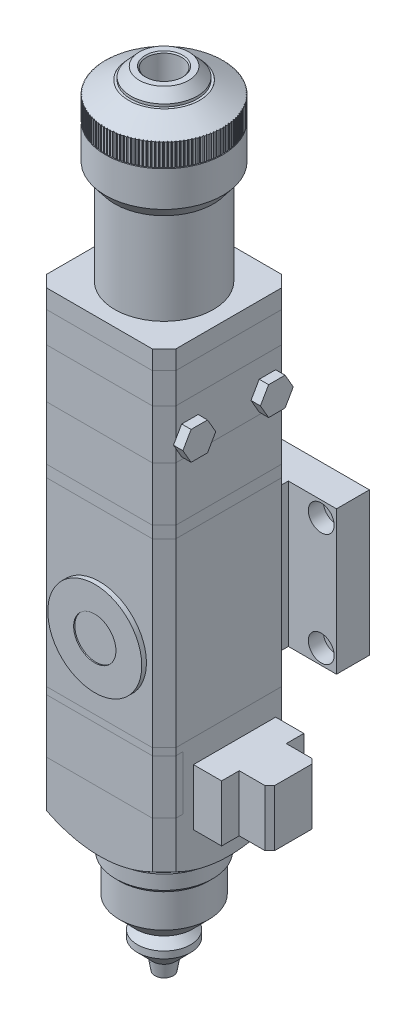
from build123d import *

# Parameters (mm, degrees)
SKETCH2_W                                    = 55
SKETCH2_H                                    = 55
BOSS_EXTRUDE1_DEPTH                          = 8
CHAMFER1_SIZE                                = 5
BOSS_EXTRUDE2_DEPTH                          = 13
BOSS_EXTRUDE3_DEPTH                          = 21
BOSS_EXTRUDE4_DEPTH                          = 23
BOSS_EXTRUDE5_DEPTH                          = 5
BOSS_EXTRUDE6_DEPTH                          = 77
BOSS_EXTRUDE7_DEPTH                          = 10
BOSS_EXTRUDE8_DEPTH                          = 25
BOSS_EXTRUDE9_DEPTH                          = 20
SKETCH15_W                                   = 81
SKETCH15_H                                   = 61
BOSS_EXTRUDE10_DEPTH                         = 14
SKETCH16_W                                   = 40
SKETCH16_H                                   = 5.4
BOSS_EXTRUDE11_DEPTH                         = 61
CBORE_FOR_M6_HEX_SOCKET_HEAD_CAP_SCR_2_COUNT = 2
CBORE_FOR_M6_HEX_SOCKET_HEAD_CAP_SCR_2_PITCH = 48
CBORE_FOR_M6_HEX_SOCKET_HEAD_CAP_SCR_3_COUNT = 2
CBORE_FOR_M6_HEX_SOCKET_HEAD_CAP_SCR_3_PITCH = 68
CBORE_FOR_M6_HEX_SOCKET_HEAD_CAP_SCR_4_COUNT = 2
CBORE_FOR_M6_HEX_SOCKET_HEAD_CAP_SCR_4_PITCH = 83.234608187
SKETCH21_R                                   = 7.5
CUT_EXTRUDE1_DEPTH                           = 64
CHAMFER2_SIZE                                = 0.5
SKETCH22_R                                   = 15.150623884
SKETCH22_R_2                                 = 14.150623884
CUT_EXTRUDE2_DEPTH                           = 5.04
CUT_EXTRUDE3_DEPTH                           = 20
CIRPATTERN1_COUNT                            = 125
SKETCH24_R                                   = 20
BOSS_EXTRUDE12_DEPTH                         = 2
SKETCH25_R                                   = 9
CUT_EXTRUDE4_DEPTH                           = 0.5
SKETCH26_W                                   = 5
SKETCH26_H                                   = 15.371413862
CUT_EXTRUDE5_DEPTH                           = 268.892703143
BOSS_EXTRUDE13_DEPTH                         = 15.371413862
BOSS_EXTRUDE14_DEPTH                         = 16
FILLET1_R                                    = 3
SKETCH29_W                                   = 55
SKETCH29_H                                   = 23
CUT_EXTRUDE6_DEPTH                           = 8
BOSS_EXTRUDE15_DEPTH                         = 23
BOSS_EXTRUDE16_DEPTH                         = 24
CHAMFER3_SIZE                                = 2
BOSS_EXTRUDE17_DEPTH                         = 4


with BuildPart() as part:
    # Sketch2 → Boss-Extrude1 (new body)
    with BuildSketch(Plane(origin=(0, 0, 0), x_dir=(1, 0, 0), z_dir=(0, 1, 0))):
        Rectangle(SKETCH2_W, SKETCH2_H)
    extrude(amount=-BOSS_EXTRUDE1_DEPTH)

    # Chamfer1
    chamfer1_edges = [part.edges().sort_by_distance(p)[0] for p in [
        (27.5, -4, 27.5),
        (-27.5, -4, 27.5),
        (-27.5, -4, -27.5),
        (27.5, -4, -27.5),
    ]]
    chamfer(chamfer1_edges, length=CHAMFER1_SIZE)

    # Sketch14 → Revolve2 (revolve)
    with BuildSketch(Plane.XY, mode=Mode.PRIVATE) as revolve2_sk:
        Polygon((0, 0), (-20.994021558, 0), (-20.994021558, 38.933369942), (-24.971974097, 44.062119831), (-24.971974097, 68.899002332), (-15.150623884, 74.207048802), (-10.497010779, 79.242887761), (0, 79.242887761), align=None)
    revolve(revolve2_sk.sketch.rotate(Axis((0, 79.242887761, 0), (0, -1, 0)), 270), axis=Axis((0, 79.242887761, 0), (0, -1, 0)))

    # Sketch21 → Cut-Extrude1 (cut)
    with BuildSketch(Plane(origin=(0, 79.242887761, 0), x_dir=(1, 0, 0), z_dir=(0, 1, 0))):
        with Locations(Location((0, 0, 0), (0, 0, 270))):
            Circle(SKETCH21_R)
    extrude(amount=-CUT_EXTRUDE1_DEPTH, mode=Mode.SUBTRACT)

    # Chamfer2
    chamfer2_edges = [part.edges().sort_by_distance(p)[0] for p in [
        (0, 79.242887761, -7.5),
    ]]
    chamfer(chamfer2_edges, length=CHAMFER2_SIZE)

    # Sketch22 → Cut-Extrude2 (cut)
    with BuildSketch(Plane(origin=(0, 79.242887761, 0), x_dir=(1, 0, 0), z_dir=(0, 1, 0))):
        with Locations(Location((0, 0, 0), (0, 0, 270))):
            Circle(SKETCH22_R)
        with Locations(Location((0, 0, 0), (0, 0, 270))):
            Circle(SKETCH22_R_2, mode=Mode.SUBTRACT)
    extrude(amount=-CUT_EXTRUDE2_DEPTH, mode=Mode.SUBTRACT)

    # Sketch23 → Cut-Extrude3 (cut)
    with BuildSketch(Plane(origin=(0, 79.242887761, 0), x_dir=(1, 0, 0), z_dir=(0, 1, 0))):
        with BuildLine():
            Line((-0.25, 24.970722663), (0, 24.671974097))
            Line((0, 24.671974097), (0.25, 24.970722663))
            ThreePointArc((0.25, 24.970722663), (0, 24.971974097), (-0.25, 24.970722663))
        make_face()
    cut_extrude3 = extrude(amount=-CUT_EXTRUDE3_DEPTH, mode=Mode.SUBTRACT)

    # CirPattern1: Cut-Extrude3 ×125 about axis
    cirpattern1_axis = Axis((0, 0, 0), (0, 1, 0))
    for i in range(1, CIRPATTERN1_COUNT):
        add(cut_extrude3.rotate(cirpattern1_axis, i * 360 / CIRPATTERN1_COUNT), mode=Mode.SUBTRACT)

    # Sketch36 → Cut-Revolve3 (revolve, cut)
    with BuildSketch(Plane.XY, mode=Mode.PRIVATE) as cut_revolve3_sk:
        Polygon((24.971974097, 59.042887761), (24.671974097, 59.242887761), (24.971974097, 59.442887761), align=None)
    revolve(cut_revolve3_sk.sketch.rotate(Axis((0, 15.242887761, 0), (0, 1, 0)), 90), axis=Axis((0, 15.242887761, 0), (0, 1, 0)), mode=Mode.SUBTRACT)


with BuildPart() as body_2:
    # Sketch4 → Boss-Extrude2 (new body)
    with BuildSketch(Plane.XZ.offset(8)):
        Polygon((27.5, -22.5), (27.5, 22.5), (22.5, 27.5), (-22.5, 27.5), (-27.5, 22.5), (-27.5, -22.5), (-22.5, -27.5), (22.5, -27.5), align=None)
    extrude(amount=BOSS_EXTRUDE2_DEPTH)


with BuildPart() as body_3:
    # Sketch5 → Boss-Extrude3 (new body)
    with BuildSketch(Plane.XZ.offset(21)):
        Polygon((-22.5, -27.5), (22.5, -27.5), (27.5, -22.5), (27.5, 22.5), (22.5, 27.5), (-22.5, 27.5), (-27.5, 22.5), (-27.5, -22.5), align=None)
    extrude(amount=BOSS_EXTRUDE3_DEPTH)


with BuildPart() as body_4:
    # Sketch6 → Boss-Extrude4 (new body)
    with BuildSketch(Plane.XZ.offset(42)):
        Polygon((-27.5, 22.5), (-27.5, -22.5), (-22.5, -27.5), (22.5, -27.5), (27.5, -22.5), (27.5, 22.5), (22.5, 27.5), (-22.5, 27.5), align=None)
    extrude(amount=BOSS_EXTRUDE4_DEPTH)


with BuildPart() as body_5:
    # Sketch7 → Boss-Extrude5 (new body)
    with BuildSketch(Plane.XZ.offset(65)):
        Polygon((22.5, 27.5), (-22.5, 27.5), (-27.5, 22.5), (-27.5, -22.5), (-22.5, -27.5), (22.5, -27.5), (27.5, -22.5), (27.5, 22.5), align=None)
    extrude(amount=BOSS_EXTRUDE5_DEPTH)


with BuildPart() as body_6:
    # Sketch8 → Boss-Extrude6 (new body)
    with BuildSketch(Plane.XZ.offset(70)):
        Polygon((27.5, -22.5), (27.5, 22.5), (22.5, 27.5), (-22.5, 27.5), (-27.5, 22.5), (-27.5, -22.5), (-22.5, -27.5), (22.5, -27.5), align=None)
    extrude(amount=BOSS_EXTRUDE6_DEPTH)



with BuildPart() as body_7:
    # Sketch9 → Boss-Extrude7 (new body)
    with BuildSketch(Plane.XZ.offset(147)):
        Polygon((-22.5, -27.5), (22.5, -27.5), (27.5, -22.5), (27.5, 22.5), (22.5, 27.5), (-22.5, 27.5), (-27.5, 22.5), (-27.5, -22.5), align=None)
    extrude(amount=BOSS_EXTRUDE7_DEPTH)


with BuildPart() as body_8:
    # Sketch10 → Boss-Extrude8 (new body)
    with BuildSketch(Plane.XZ.offset(157)):
        Polygon((-27.5, 22.5), (-27.5, -22.5), (-22.5, -27.5), (22.5, -27.5), (27.5, -22.5), (27.5, 22.5), (22.5, 27.5), (-22.5, 27.5), align=None)
    extrude(amount=BOSS_EXTRUDE8_DEPTH)

    # Sketch11 → Boss-Extrude9 (add)
    with BuildSketch(Plane.XZ.offset(182)):
        Polygon((22.5, 27.5), (-22.5, 27.5), (-27.5, 22.5), (-27.5, -22.5), (-22.5, -27.5), (22.5, -27.5), (27.5, -22.5), (27.5, 22.5), align=None)
    extrude(amount=BOSS_EXTRUDE9_DEPTH)

    # Sketch12 → Cut-Revolve1 (revolve, cut)
    with BuildSketch(Plane.XY, mode=Mode.PRIVATE) as cut_revolve1_sk:
        with BuildLine():
            Line((0, -254), (0, -202))
            Line((0, -202), (-20, -202))
            ThreePointArc((-20, -202), (-32.308689997, -195.162491871), (-43, -186))
            Line((-43, -186), (-43, -254))
            Line((-43, -254), (0, -254))
        make_face()
    revolve(cut_revolve1_sk.sketch.rotate(Axis((0, -254, 0), (0, 1, 0)), 320.710593135), axis=Axis((0, -254, 0), (0, 1, 0)), mode=Mode.SUBTRACT)

    # Sketch13 → Revolve1 (revolve)
    with BuildSketch(Plane.XY):
        Polygon((0, -202), (0, -254.147379285), (-3.915080853, -254.147379285), (-4.86862575, -248.438472983), (-11.342693732, -241.864031854), (-11.342693732, -238.953210591), (-7.578700719, -235.992202754), (-7.578700719, -232.880635197), (-12.095492334, -232.880635197), (-19.048958316, -225.819363541), (-19.048958316, -211.664827775), (-20.655662747, -210.033213199), (-20.655662747, -204.023846761), (-20, -202), align=None)
    revolve(axis=Axis((0, -202, 0), (0, -1, 0)))


with BuildPart() as body_9:
    # Sketch15 → Boss-Extrude10 (new body)
    with BuildSketch(Plane.XY.offset(-46.9)):
        with Locations((0, -110.647379285)):
            Rectangle(SKETCH15_W, SKETCH15_H)
    extrude(amount=BOSS_EXTRUDE10_DEPTH)


with BuildPart() as body_6_1:
    add(body_6.part)

    add(body_9.part)  # Boss-Extrude11 merges body 9
    # Sketch16 → Boss-Extrude11 (add)
    with BuildSketch(Plane(origin=(0, -80.147379285, 0), x_dir=(1, 0, 0), z_dir=(0, 1, 0))):
        with Locations((0, 30.2)):
            Rectangle(SKETCH16_W, SKETCH16_H)
    extrude(amount=-BOSS_EXTRUDE11_DEPTH)

    # Sketch20 → CBORE for M6 Hex Socket Head Cap Screw1 (revolve, cut)
    with BuildSketch(Plane(origin=(-34, -86.727198442, -32.9), x_dir=(0, -1, 0), z_dir=(1, 0, 0))):
        Polygon((0, 0), (0, 14), (3.2, 14), (3.2, 6.4), (5.5, 6.4), (5.5, 0), align=None)
    cbore_for_m6_hex_socket_head_cap_screw1 = revolve(axis=Axis((-34, -86.727198442, -26.55), (0, 0, -1)), mode=Mode.SUBTRACT)

    # CBORE for M6 Hex Socket Head Cap Scr 2: CBORE for M6 Hex Socket Head Cap Screw1 ×2
    with Locations(*[(0, -i * CBORE_FOR_M6_HEX_SOCKET_HEAD_CAP_SCR_2_PITCH, 0) for i in range(1, CBORE_FOR_M6_HEX_SOCKET_HEAD_CAP_SCR_2_COUNT)]):
        add(cbore_for_m6_hex_socket_head_cap_screw1, mode=Mode.SUBTRACT)

    # CBORE for M6 Hex Socket Head Cap Scr 3: CBORE for M6 Hex Socket Head Cap Screw1 ×2
    with Locations(*[(i * CBORE_FOR_M6_HEX_SOCKET_HEAD_CAP_SCR_3_PITCH, 0, 0) for i in range(1, CBORE_FOR_M6_HEX_SOCKET_HEAD_CAP_SCR_3_COUNT)]):
        add(cbore_for_m6_hex_socket_head_cap_screw1, mode=Mode.SUBTRACT)

    # CBORE for M6 Hex Socket Head Cap Scr 4: CBORE for M6 Hex Socket Head Cap Screw1 ×2
    with Locations(*[Vector(0.8169678632647617, -0.5766831975986554, 0) * (i * CBORE_FOR_M6_HEX_SOCKET_HEAD_CAP_SCR_4_PITCH) for i in range(1, CBORE_FOR_M6_HEX_SOCKET_HEAD_CAP_SCR_4_COUNT)]):
        add(cbore_for_m6_hex_socket_head_cap_screw1, mode=Mode.SUBTRACT)

    # Sketch24 → Boss-Extrude12 (add)
    with BuildSketch(Plane.XY.offset(27.5)):
        with Locations((0, -117)):
            Circle(SKETCH24_R)
    extrude(amount=BOSS_EXTRUDE12_DEPTH)

    # Sketch25 → Cut-Extrude4 (cut)
    with BuildSketch(Plane.XY.offset(29.5)):
        with Locations((0, -117)):
            Circle(SKETCH25_R)
    extrude(amount=-CUT_EXTRUDE4_DEPTH, mode=Mode.SUBTRACT)


with BuildPart() as cut_extrude5_tool:
    # Sketch26 → Cut-Extrude5 (new, through all)
    with BuildSketch(Plane.XY.offset(27.5)):
        with Locations((-25, -24.70349511)):
            Rectangle(SKETCH26_W, SKETCH26_H)
    extrude(amount=-CUT_EXTRUDE5_DEPTH)


with BuildPart() as body_2_1:
    add(body_2.part)

    # Cut-Extrude5: cut by cut_extrude5_tool
    add(cut_extrude5_tool.part, mode=Mode.SUBTRACT)


with BuildPart() as body_3_1:
    add(body_3.part)

    # Cut-Extrude5: cut by cut_extrude5_tool
    add(cut_extrude5_tool.part, mode=Mode.SUBTRACT)

    # Sketch34 → Boss-Extrude17 (add)
    with BuildSketch(Plane(origin=(27.5, 0, 0), x_dir=(0, 0, -1), z_dir=(1, 0, 0))):
        Polygon((-9.5, -35), (-13, -28.937822174), (-20, -28.937822174), (-23.5, -35), (-20, -41.062177826), (-13, -41.062177826), align=None)
        Polygon((9.5, -35), (13, -41.062177826), (20, -41.062177826), (23.5, -35), (20, -28.937822174), (13, -28.937822174), align=None)
    extrude(amount=BOSS_EXTRUDE17_DEPTH)


with BuildPart() as body_9_2:
    # Sketch27 → Boss-Extrude13 (new body)
    with BuildSketch(Plane(origin=(0, -32.389202041, 0), x_dir=(1, 0, 0), z_dir=(0, 1, 0))):
        Polygon((-22.5, -27.5), (-22.5, 27.5), (-27.5, 22.5), (-27.5, -22.5), align=None)
    extrude(amount=BOSS_EXTRUDE13_DEPTH)

    # Sketch28 → Boss-Extrude14 (add, symmetric)
    with BuildSketch(Plane.XY):
        Polygon((-27.5, -32.389202041), (-32, -27.889202041), (-32, -10.389202041), (-27.5, -10.389202041), align=None)
    extrude(amount=BOSS_EXTRUDE14_DEPTH, both=True)

    # Fillet1
    fillet1_edges = [body_9_2.edges().sort_by_distance(p)[0] for p in [
        (-29.75, -10.389202041, -16),
        (-29.75, -10.389202041, 16),
    ]]
    fillet(fillet1_edges, radius=FILLET1_R)


with BuildPart() as cut_extrude6_tool:
    # Sketch29 → Cut-Extrude6 (new body)
    with BuildSketch(Plane.XY.offset(27.5)):
        with Locations((0, -161.5)):
            Rectangle(SKETCH29_W, SKETCH29_H)
    extrude(amount=-CUT_EXTRUDE6_DEPTH)


with BuildPart() as body_7_1:
    add(body_7.part)

    # Cut-Extrude6: cut by cut_extrude6_tool
    add(cut_extrude6_tool.part, mode=Mode.SUBTRACT)



with BuildPart() as body_8_1:
    add(body_8.part)

    # Cut-Extrude6: cut by cut_extrude6_tool
    add(cut_extrude6_tool.part, mode=Mode.SUBTRACT)


with BuildPart() as body_10:
    # Sketch30 → Boss-Extrude15 (new body)
    with BuildSketch(Plane(origin=(0, -173, 0), x_dir=(1, 0, 0), z_dir=(0, 1, 0))):
        Polygon((27.5, -22.5), (27.5, -19.5), (-27.5, -19.5), (-27.5, -22.5), (-22.5, -27.5), (22.5, -27.5), align=None)
    extrude(amount=BOSS_EXTRUDE15_DEPTH)


with BuildPart() as body_7_2:
    add(body_7_1.part)

    add(body_8_1.part)  # Boss-Extrude16 merges body 8
    # Sketch31 → Boss-Extrude16 (add)
    with BuildSketch(Plane.XZ.offset(157)):
        Polygon((27.5, 15), (39.5, 15), (39.5, 7.5), (52.5, 7.5), (52.5, -12.5), (39.5, -12.5), (39.5, -20), (27.5, -20), align=None)
    extrude(amount=BOSS_EXTRUDE16_DEPTH)

    # Chamfer3
    chamfer3_edges = [body_7_2.edges().sort_by_distance(p)[0] for p in [
        (52.5, -169, -12.5),
        (52.5, -169, 7.5),
    ]]
    chamfer(chamfer3_edges, length=CHAMFER3_SIZE)


solid = Compound([part.part, body_4.part, body_5.part, body_6_1.part, body_2_1.part, body_3_1.part, body_9_2.part, body_10.part, body_7_2.part])
